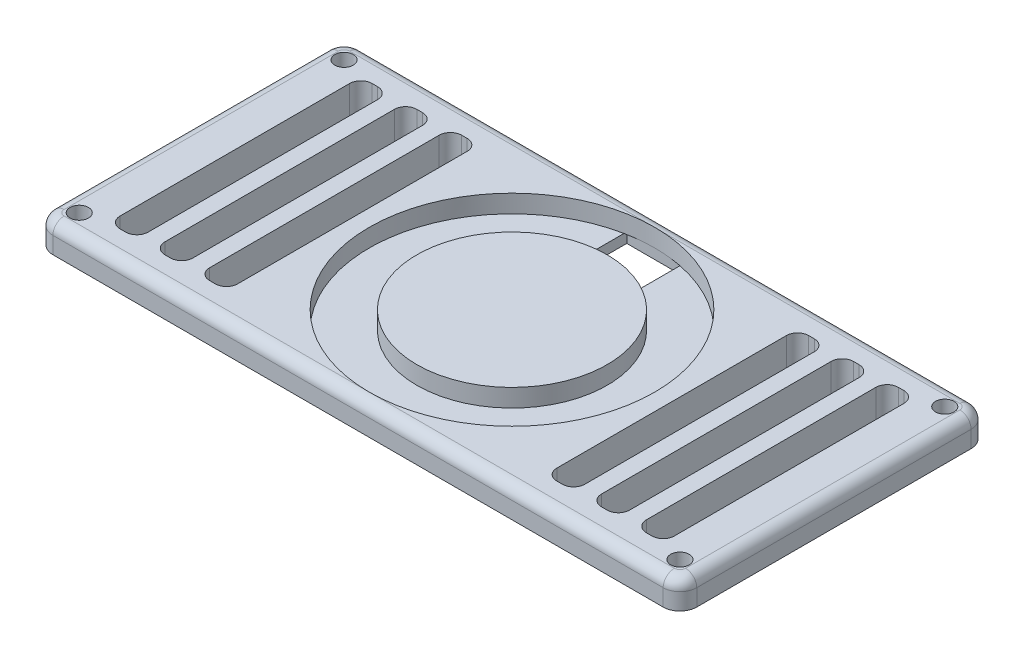
from build123d import *

# Parameters (mm, degrees)
EXTRUDE_1_DEPTH     = 5
SKETCH_2_R          = 25.5
SKETCH_2_R_2        = 17
CUT_EXTRUDE_1_DEPTH = 3.2
CUT_EXTRUDE_2_DEPTH = 18.2
FILLET_1_R          = 2
SKETCH_4_W          = 1.7
SKETCH_4_H          = 1.7
CUT_EXTRUDE_3_DEPTH = 71
SKETCH_5_R          = 1.65
CUT_EXTRUDE_4_DEPTH = 3
SKETCH_6_W          = 10
SKETCH_6_H          = 7.8
CUT_EXTRUDE_5_DEPTH = 9.4


with BuildPart() as part:
    # Эскиз1 → Бобышка-Вытянуть1 (new body)
    with BuildSketch(Plane(origin=(0, 0, 0), x_dir=(1, 0, 0), z_dir=(0, 1, 0))):
        with BuildLine():
            Line((-52.404740413, 37.47648532), (56.595259587, 37.47648532))
            ThreePointArc((56.595259587, 37.47648532), (58.716579931, 36.597805664), (59.595259587, 34.47648532))
            Line((59.595259587, 34.47648532), (59.595259587, -14.52351468))
            ThreePointArc((59.595259587, -14.52351468), (58.716579931, -16.644835023), (56.595259587, -17.52351468))
            Line((56.595259587, -17.52351468), (-52.404740413, -17.52351468))
            ThreePointArc((-52.404740413, -17.52351468), (-54.526060756, -16.644835023), (-55.404740413, -14.52351468))
            Line((-55.404740413, -14.52351468), (-55.404740413, 34.47648532))
            ThreePointArc((-55.404740413, 34.47648532), (-54.526060756, 36.597805664), (-52.404740413, 37.47648532))
        make_face()
    extrude(amount=EXTRUDE_1_DEPTH)

    # Эскиз2 → Вырез-Вытянуть1 (cut)
    with BuildSketch(Plane(origin=(0, 5, 0), x_dir=(1, 0, 0), z_dir=(0, 1, 0))):
        with Locations(Location((2.095259587, 9.97648532, 0), (0, 0, 270))):
            Circle(SKETCH_2_R)
        with Locations(Location((2.095259587, 9.97648532, 0), (0, 0, 270))):
            Circle(SKETCH_2_R_2, mode=Mode.SUBTRACT)
    extrude(amount=-CUT_EXTRUDE_1_DEPTH, mode=Mode.SUBTRACT)

    # Эскиз3 → Вырез-Вытянуть2 (cut)
    with BuildSketch(Plane(origin=(0, 5, 0), x_dir=(1, 0, 0), z_dir=(0, 1, 0))):
        with BuildLine():
            Line((-45.404740413, 32.47648532), (-44.404740413, 32.47648532))
            ThreePointArc((-44.404740413, 32.47648532), (-42.99052685, 31.890698883), (-42.404740413, 30.47648532))
            Line((-42.404740413, 30.47648532), (-42.404740413, -10.52351468))
            ThreePointArc((-42.404740413, -10.52351468), (-42.99052685, -11.937728242), (-44.404740413, -12.52351468))
            Line((-44.404740413, -12.52351468), (-45.404740413, -12.52351468))
            ThreePointArc((-45.404740413, -12.52351468), (-46.818953975, -11.937728242), (-47.404740413, -10.52351468))
            Line((-47.404740413, -10.52351468), (-47.404740413, 30.47648532))
            ThreePointArc((-47.404740413, 30.47648532), (-46.818953975, 31.890698883), (-45.404740413, 32.47648532))
        make_face()
        with BuildLine():
            Line((-37.404740413, 32.47648532), (-36.404740413, 32.47648532))
            ThreePointArc((-36.404740413, 32.47648532), (-34.99052685, 31.890698883), (-34.404740413, 30.47648532))
            Line((-34.404740413, 30.47648532), (-34.404740413, -10.52351468))
            ThreePointArc((-34.404740413, -10.52351468), (-34.99052685, -11.937728242), (-36.404740413, -12.52351468))
            Line((-36.404740413, -12.52351468), (-37.404740413, -12.52351468))
            ThreePointArc((-37.404740413, -12.52351468), (-38.818953975, -11.937728242), (-39.404740413, -10.52351468))
            Line((-39.404740413, -10.52351468), (-39.404740413, 30.47648532))
            ThreePointArc((-39.404740413, 30.47648532), (-38.818953975, 31.890698883), (-37.404740413, 32.47648532))
        make_face()
        with BuildLine():
            Line((-29.404740413, 32.47648532), (-28.404740413, 32.47648532))
            ThreePointArc((-28.404740413, 32.47648532), (-26.99052685, 31.890698883), (-26.404740413, 30.47648532))
            Line((-26.404740413, 30.47648532), (-26.404740413, -10.52351468))
            ThreePointArc((-26.404740413, -10.52351468), (-26.99052685, -11.937728242), (-28.404740413, -12.52351468))
            Line((-28.404740413, -12.52351468), (-29.404740413, -12.52351468))
            ThreePointArc((-29.404740413, -12.52351468), (-30.818953975, -11.937728242), (-31.404740413, -10.52351468))
            Line((-31.404740413, -10.52351468), (-31.404740413, 30.47648532))
            ThreePointArc((-31.404740413, 30.47648532), (-30.818953975, 31.890698883), (-29.404740413, 32.47648532))
        make_face()
        with BuildLine():
            Line((49.595259587, 32.47648532), (48.595259587, 32.47648532))
            ThreePointArc((48.595259587, 32.47648532), (47.181046025, 31.890698883), (46.595259587, 30.47648532))
            Line((46.595259587, 30.47648532), (46.595259587, -10.52351468))
            ThreePointArc((46.595259587, -10.52351468), (47.181046025, -11.937728242), (48.595259587, -12.52351468))
            Line((48.595259587, -12.52351468), (49.595259587, -12.52351468))
            ThreePointArc((49.595259587, -12.52351468), (51.00947315, -11.937728242), (51.595259587, -10.52351468))
            Line((51.595259587, -10.52351468), (51.595259587, 30.47648532))
            ThreePointArc((51.595259587, 30.47648532), (51.00947315, 31.890698883), (49.595259587, 32.47648532))
        make_face()
        with BuildLine():
            Line((41.595259587, 32.47648532), (40.595259587, 32.47648532))
            ThreePointArc((40.595259587, 32.47648532), (39.181046025, 31.890698883), (38.595259587, 30.47648532))
            Line((38.595259587, 30.47648532), (38.595259587, -10.52351468))
            ThreePointArc((38.595259587, -10.52351468), (39.181046025, -11.937728242), (40.595259587, -12.52351468))
            Line((40.595259587, -12.52351468), (41.595259587, -12.52351468))
            ThreePointArc((41.595259587, -12.52351468), (43.00947315, -11.937728242), (43.595259587, -10.52351468))
            Line((43.595259587, -10.52351468), (43.595259587, 30.47648532))
            ThreePointArc((43.595259587, 30.47648532), (43.00947315, 31.890698883), (41.595259587, 32.47648532))
        make_face()
        with BuildLine():
            Line((33.595259587, 32.47648532), (32.595259587, 32.47648532))
            ThreePointArc((32.595259587, 32.47648532), (31.181046025, 31.890698883), (30.595259587, 30.47648532))
            Line((30.595259587, 30.47648532), (30.595259587, -10.52351468))
            ThreePointArc((30.595259587, -10.52351468), (31.181046025, -11.937728242), (32.595259587, -12.52351468))
            Line((32.595259587, -12.52351468), (33.595259587, -12.52351468))
            ThreePointArc((33.595259587, -12.52351468), (35.00947315, -11.937728242), (35.595259587, -10.52351468))
            Line((35.595259587, -10.52351468), (35.595259587, 30.47648532))
            ThreePointArc((35.595259587, 30.47648532), (35.00947315, 31.890698883), (33.595259587, 32.47648532))
        make_face()
    extrude(amount=-CUT_EXTRUDE_2_DEPTH, mode=Mode.SUBTRACT)

    # Скругление1
    fillet_1_edges = [part.edges().sort_by_distance(p)[0] for p in [
        (58.716579931, 5, 16.644835023),
        (59.595259587, 5, -9.97648532),
        (58.716579931, 5, -36.597805664),
        (2.095259587, 5, -37.47648532),
        (-54.526060756, 5, -36.597805664),
        (-55.404740413, 5, -9.97648532),
        (-54.526060756, 5, 16.644835023),
        (2.095259587, 5, 17.52351468),
    ]]
    fillet(fillet_1_edges, radius=FILLET_1_R - 0.0001)  # a hair under: the kernel refuses the full size

    # Эскиз4 → Вырез-Вытянуть3 (cut)
    with BuildSketch(Plane.XZ):
        with Locations((-51.554740413, 13.67351468)):
            Rectangle(SKETCH_4_W, SKETCH_4_H)
        with Locations((-51.554740413, -33.62648532)):
            Rectangle(SKETCH_4_W, SKETCH_4_H)
        with Locations((55.745259587, -33.62648532)):
            Rectangle(SKETCH_4_W, SKETCH_4_H)
        with Locations((55.745259587, 13.67351468)):
            Rectangle(SKETCH_4_W, SKETCH_4_H)
    extrude(amount=-CUT_EXTRUDE_3_DEPTH, mode=Mode.SUBTRACT)

    # Эскиз5 → Вырез-Вытянуть4 (cut)
    with BuildSketch(Plane(origin=(0, 5, 0), x_dir=(1, 0, 0), z_dir=(0, 1, 0))):
        with Locations(Location((-51.554740413, 33.62648532, 0), (0, 0, 270))):
            Circle(SKETCH_5_R)
        with Locations(Location((-51.554740413, -13.67351468, 0), (0, 0, 270))):
            Circle(SKETCH_5_R)
        with Locations(Location((55.745259587, 33.62648532, 0), (0, 0, 270))):
            Circle(SKETCH_5_R)
        with Locations(Location((55.745259587, -13.67351468, 0), (0, 0, 270))):
            Circle(SKETCH_5_R)
    extrude(amount=-CUT_EXTRUDE_4_DEPTH, mode=Mode.SUBTRACT)

    # Эскиз6 → Вырез-Вытянуть5 (cut)
    with BuildSketch(Plane(origin=(0, 1.8, 0), x_dir=(1, 0, 0), z_dir=(0, 1, 0))):
        with Locations((2.095259587, 31.57648532)):
            Rectangle(SKETCH_6_W, SKETCH_6_H)
    extrude(amount=-CUT_EXTRUDE_5_DEPTH, mode=Mode.SUBTRACT)


solid = part.part
